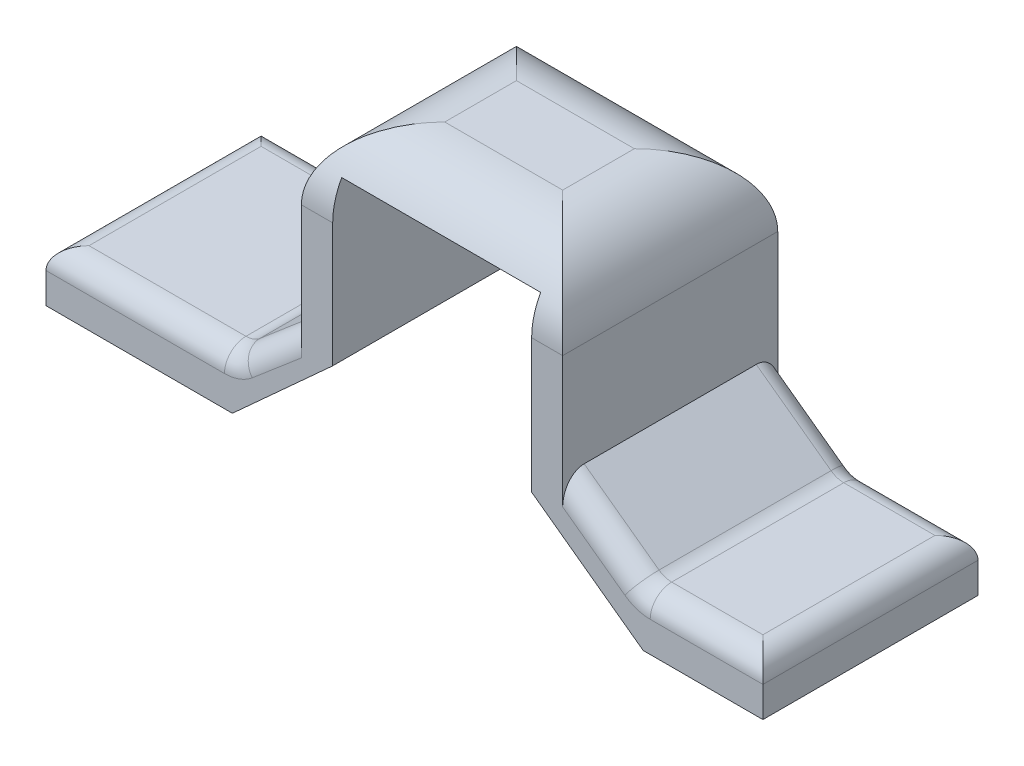
from build123d import *

# Parameters (mm, degrees)
SKETCH_1_W          = 1
SKETCH_1_H          = 0.4
EXTRUDE_1_DEPTH     = 0.3
SKETCH_2_OUTSIDE_W  = 3.224
SKETCH_2_OUTSIDE_H  = 2.624
CUT_EXTRUDE_1_DEPTH = 0.7
FILLET_1_R          = 0.1
FILLET_2_R          = 0.03


with BuildPart() as part:
    # 草图1 → 凸台-拉伸1 (new body)
    with BuildSketch(Plane.XY):
        with Locations((0.5, 0.2)):
            Rectangle(SKETCH_1_W, SKETCH_1_H)
    extrude(amount=EXTRUDE_1_DEPTH)

    # 草图2 outside → 切除-拉伸1 (cut)
    with BuildSketch(Plane.XY.offset(0.3)):
        with Locations((0.5, 0.2)):
            Rectangle(SKETCH_2_OUTSIDE_W, SKETCH_2_OUTSIDE_H)
        Polygon((0, 0.072506772), (0.259947675, 0.072506772), (0.356189851, 0.154367934), (0.356189851, 0.4), (0.720693267, 0.4), (0.720693267, 0.154367934), (0.832975806, 0.072506772), (1, 0.072506772), (1, 0), (0.832975806, 0), (0.67738268, 0.113437353), (0.67738268, 0.348511634), (0.399886012, 0.348511634), (0.399886012, 0.127265252), (0.259947675, 0), (0, 0), align=None, mode=Mode.SUBTRACT)
    extrude(amount=-CUT_EXTRUDE_1_DEPTH, mode=Mode.SUBTRACT)

    # 圆角1
    # the kernel refuses this fillet: 0.1 mm, written as the material it takes off along each edge
    with BuildSketch(Plane(origin=(0.970693267, 0.4, 0), x_dir=(0, -1, 0), z_dir=(-1, 0, 0)), Plane(origin=(0.106189851, 0.4, 0.3), x_dir=(0, -1, 0), z_dir=(1, 0, 0))) as fillet_1_piece_1:
        with BuildLine():
            CenterArc((FILLET_1_R, FILLET_1_R), FILLET_1_R, 180, 90)
            Line((0, FILLET_1_R), (0, 0))
            Line((0, 0), (FILLET_1_R, 0))
        make_face()
    extrude(amount=0.864503415, mode=Mode.SUBTRACT)
    with BuildSketch(Plane(origin=(0.720693267, 0.4, 0.55), x_dir=(-1, 0, 0), z_dir=(0, 0, -1)), Plane(origin=(0.356189851, 0.4, 0.55), x_dir=(0, -1, 0), z_dir=(0, 0, -1))) as fillet_1_piece_2:
        with BuildLine():
            CenterArc((FILLET_1_R, -FILLET_1_R), FILLET_1_R, 90, 90)
            Line((0, -FILLET_1_R), (0, 0))
            Line((0, 0), (FILLET_1_R, 0))
        make_face()
    extrude(amount=0.8, mode=Mode.SUBTRACT)

    # 圆角2
    fillet_2_edges = [part.edges().sort_by_distance(p)[0] for p in [
        (0.916487903, 0.072506772, 0),
        (0.776834536, 0.113437353, 0),
        (0.308068763, 0.113437353, 0),
        (0.129973837, 0.072506772, 0),
        (0, 0.072506772, 0.15),
        (0.259947675, 0.072506772, 0.15),
        (0.129973837, 0.072506772, 0.3),
        (0.308068763, 0.113437353, 0.3),
        (0.832975806, 0.072506772, 0.15),
        (0.776834536, 0.113437353, 0.3),
        (1, 0.072506772, 0.15),
        (0.916487903, 0.072506772, 0.3),
    ]]
    fillet(fillet_2_edges, radius=FILLET_2_R)


solid = part.part
